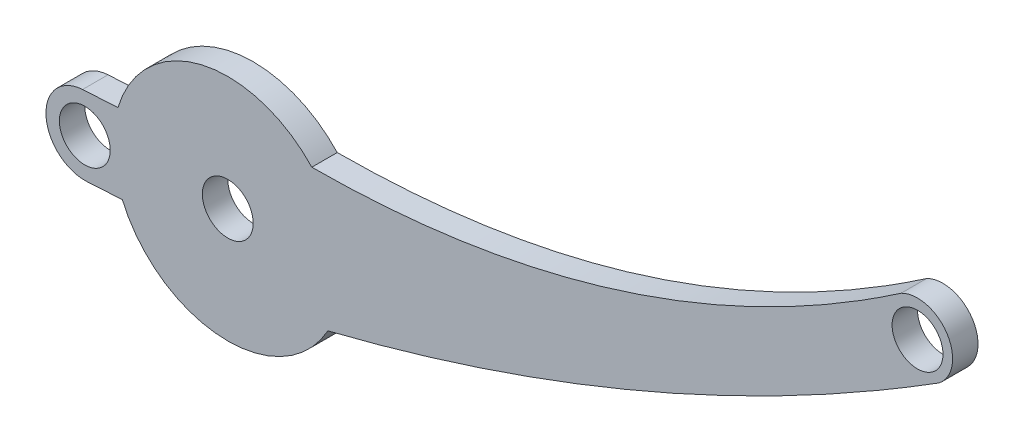
from build123d import *

# Parameters (mm, degrees)
SKETCH1_R           = 4
BOSS_EXTRUDE1_DEPTH = 2
SHELL1_START        = -2
SHELL1_OUTLINE_R    = 4.8
SHELL1_DEPTH        = 3.2


# Read off the part's stored shape, not the designer's step: Shell1
with BuildPart() as part:
    # Sketch1 → Boss-Extrude1 (new, symmetric)
    with BuildSketch(Plane.XY):
        with BuildLine():
            Line((-17.273333042, 5.134508518), (-22.834943086, 4.817083449))
            ThreePointArc((-22.834943086, 4.817083449), (-28.587261134, -1.63159827), (-22.138579415, -7.383916318))
            Line((-22.138579415, -7.383916318), (-16.576969371, -7.066491249))
            ThreePointArc((-16.576969371, -7.066491249), (-0.944763396, -17.995517059), (15.7458991, -8.7634396))
            add(Edge.make_bspline(
                [(15.7458991, -8.7634396), (67.083909385, 4.041585312), (111.853607553, 32.193205755)],
                knots=[0, 0, 0, 1, 1, 1], degree=2))
            ThreePointArc((111.853607553, 32.193205755), (113.10751986, 39.543134952), (105.896265572, 41.438277917))
            add(Edge.make_bspline(
                [(105.896265572, 41.438277917), (63.525953211, 12.424095607), (13.212454281, 12.254071322)],
                knots=[0.987896241, 0.987896241, 0.987896241, 1.987896241, 1.987896241, 1.987896241], degree=2))
            ThreePointArc((13.212454281, 12.254071322), (-4.098137102, 17.548119112), (-17.273333042, 5.134508518))
        make_face()
        with Locations((-22.486761251, -1.283416434)):
            Circle(SKETCH1_R, mode=Mode.SUBTRACT)
        Circle(SKETCH1_R, mode=Mode.SUBTRACT)
        with Locations((108.469927907, 36.408671583)):
            Circle(SKETCH1_R, mode=Mode.SUBTRACT)
    extrude(amount=BOSS_EXTRUDE1_DEPTH, both=True)

    # Shell1 outline → Shell1 (cut)
    with BuildSketch(Plane.XY.offset(SHELL1_START)):
        with BuildLine():
            ThreePointArc((-16.051816298, -6.235216567), (-1.010183418, -17.190644594), (15.211053739, -8.072334002))
            add(Edge.make_bspline(
                [(15.211053739, -8.072334002), (15.222385933, -8.06950746), (15.233718127, -8.066680918), (15.245050322, -8.063854377), (15.256382516, -8.061027835), (15.26771471, -8.058201293), (15.279046904, -8.055374751), (15.290379098, -8.05254821), (15.301711293, -8.049721668), (15.313043487, -8.046895126), (15.324375681, -8.044068584), (15.354121011, -8.036649331), (15.372534147, -8.03205662), (15.390947283, -8.027463909), (15.409360418, -8.022871197), (15.427773554, -8.018278486), (15.44618669, -8.013685775), (15.464599826, -8.009093063), (15.483012962, -8.004500352), (15.501426097, -7.999907641), (15.519839233, -7.995314929), (15.540554011, -7.990148129), (15.542858699, -7.989573289), (15.545136117, -7.989005183), (15.547530208, -7.988408212), (15.549617399, -7.987887312), (15.552237019, -7.987234194), (15.554249413, -7.98673216), (15.556693958, -7.986122386), (15.558944951, -7.985560901), (15.5612476, -7.984986493), (15.56583998, -7.983840868), (15.568136163, -7.983268038), (15.570432338, -7.982695192), (15.572728507, -7.982122328), (15.575024668, -7.981549448), (15.577320821, -7.980976551), (15.579616968, -7.980403637), (15.581913107, -7.979830706), (15.584209239, -7.979257758), (15.586505364, -7.978684793), (15.593393716, -7.976965848), (15.597985921, -7.975819817), (15.602578098, -7.974673718), (15.607170246, -7.973527552), (15.611762364, -7.972381317), (15.616354454, -7.971235016), (15.620946514, -7.970088646), (15.625538546, -7.968942209), (15.630130548, -7.967795704), (15.634722521, -7.966649131), (15.648498354, -7.96320921), (15.657682126, -7.960915659), (15.666865782, -7.958621837), (15.676049322, -7.956327744), (15.685232745, -7.954033381), (15.694416052, -7.951738746), (15.703599244, -7.949443841), (15.712782318, -7.947148666), (15.721965277, -7.944853219), (15.731148119, -7.942557502), (15.77706175, -7.931077562), (15.813790795, -7.921889279), (15.85051798, -7.912696664), (15.887243306, -7.903499717), (15.923966772, -7.894298439), (15.960688378, -7.885092829), (15.997408124, -7.875882887), (16.034126012, -7.866668613), (16.070842039, -7.857450008), (16.107556207, -7.848227071), (16.291117748, -7.802090727), (16.437937227, -7.765112345), (16.584726952, -7.728064656), (16.731486924, -7.690947659), (16.878217144, -7.653761355), (17.02491761, -7.616505744), (17.171588325, -7.579180826), (17.318229287, -7.5417866), (17.464840497, -7.504323068), (17.611421956, -7.466790228), (18.05107708, -7.353983788), (18.34406149, -7.278502266), (18.636926899, -7.202743515), (18.929673307, -7.126707537), (19.222300717, -7.050394331), (19.514809132, -6.973803896), (19.807198553, -6.896936234), (20.099468984, -6.819791344), (20.391620426, -6.742369227), (20.683652882, -6.664669882), (21.559393298, -6.430740165), (22.142744307, -6.273678112), (22.725619399, -6.11550715), (23.308018593, -5.956227279), (23.889941907, -5.795838499), (24.471389362, -5.63434081), (25.052360976, -5.471734213), (25.632856767, -5.308018707), (26.212876755, -5.143194292), (26.792420958, -4.977260969), (28.529626269, -4.476134272), (29.68586008, -4.137614183), (30.84019098, -3.794658457), (31.992619122, -3.447267078), (33.143144661, -3.095440033), (34.29176775, -2.739177308), (35.438488542, -2.378478888), (36.583307191, -2.01334476), (37.726223851, -1.64377491), (38.867238673, -1.269769323), (42.284578093, -0.134445311), (44.55519768, 0.640180196), (46.818211791, 1.432548876), (49.073621643, 2.242661072), (51.32142845, 3.070517125), (53.561633431, 3.916117378), (55.794237801, 4.779462172), (58.019242777, 5.660551849), (60.236649574, 6.559386751), (62.44645941, 7.47596722), (68.878655155, 10.20493448), (73.080612538, 12.065048094), (77.254554243, 13.99063813), (81.400488497, 15.981708647), (85.518423161, 18.038264067), (89.608365726, 20.16030918), (93.67032332, 22.347849143), (97.704302702, 24.600889477), (101.710310261, 26.919436071), (105.688352025, 29.30349518), (109.638433649, 31.753073424)],
                knots=[-0.003323428, -0.003323428, -0.003323428, -0.003323428, -0.003323428, -0.003323428, -0.003323428, -0.003323428, -0.003323428, -0.003323428, -0.003323428, -0.003323428, -0.002109375, -0.002109375, -0.002109375, -0.002109375, -0.002109375, -0.002109375, -0.002109375, -0.002109375, -0.002109375, -0.002109375, -0.000136719, -0.000136719, -0.000136719, -0.000136719, -0.000136719, -0.000136719, -0.000136719, -0.000136719, -0.000136719, -0.000136719, 0.000109863, 0.000109863, 0.000109863, 0.000109863, 0.000109863, 0.000109863, 0.000109863, 0.000109863, 0.000109863, 0.000109863, 0.000356445, 0.000356445, 0.000356445, 0.000356445, 0.000356445, 0.000356445, 0.000356445, 0.000356445, 0.000356445, 0.000356445, 0.000849609, 0.000849609, 0.000849609, 0.000849609, 0.000849609, 0.000849609, 0.000849609, 0.000849609, 0.000849609, 0.000849609, 0.001835937, 0.001835937, 0.001835937, 0.001835937, 0.001835937, 0.001835937, 0.001835937, 0.001835937, 0.001835937, 0.001835937, 0.00578125, 0.00578125, 0.00578125, 0.00578125, 0.00578125, 0.00578125, 0.00578125, 0.00578125, 0.00578125, 0.00578125, 0.0215625, 0.0215625, 0.0215625, 0.0215625, 0.0215625, 0.0215625, 0.0215625, 0.0215625, 0.0215625, 0.0215625, 0.053125, 0.053125, 0.053125, 0.053125, 0.053125, 0.053125, 0.053125, 0.053125, 0.053125, 0.053125, 0.11625, 0.11625, 0.11625, 0.11625, 0.11625, 0.11625, 0.11625, 0.11625, 0.11625, 0.11625, 0.2425, 0.2425, 0.2425, 0.2425, 0.2425, 0.2425, 0.2425, 0.2425, 0.2425, 0.2425, 0.495, 0.495, 0.495, 0.495, 0.495, 0.495, 0.495, 0.495, 0.495, 0.495, 0.979998426, 0.979998426, 0.979998426, 0.979998426, 0.979998426, 0.979998426, 0.979998426, 0.979998426, 0.979998426, 0.979998426, 0.979998426, 0.979998426], degree=11))
            ThreePointArc((109.638433649, 31.753073424), (103.967828672, 38.073334454), (112.386109536, 39.184193417))
            ThreePointArc((112.386109536, 39.184193417), (109.645338699, 41.123948782), (106.30837764, 40.75089845))
            add(Edge.make_bspline(
                [(12.859642213, 11.452874497), (12.875559482, 11.452928286), (12.89147675, 11.452982075), (12.907394019, 11.453035864), (12.923311287, 11.453089654), (12.939228556, 11.453143443), (12.955145825, 11.453197232), (12.971063093, 11.453251021), (12.986980362, 11.45330481), (13.024953461, 11.453433133), (13.047009292, 11.453507666), (13.069065122, 11.453582199), (13.091120953, 11.453656732), (13.113176784, 11.453731266), (13.135232614, 11.453805799), (13.157288445, 11.453880332), (13.179344276, 11.453954865), (13.202778596, 11.454034057), (13.204157085, 11.454038715), (13.205535575, 11.454043373), (13.206914064, 11.454048032), (13.208292554, 11.45405269), (13.209671043, 11.454057348), (13.211049532, 11.454062007), (13.212428022, 11.454066665), (13.215185001, 11.454075982), (13.216554492, 11.454080606), (13.217987164, 11.45408545), (13.219302057, 11.454089949), (13.220750975, 11.45409485), (13.222097481, 11.454099473), (13.223496126, 11.454104254), (13.224878499, 11.454109002), (13.229032762, 11.454123302), (13.231802257, 11.454132885), (13.234571739, 11.454142516), (13.237341208, 11.454152197), (13.240110663, 11.454161926), (13.242880105, 11.454171704), (13.245649534, 11.454181531), (13.248418949, 11.454191408), (13.256727156, 11.454221183), (13.262265907, 11.454241229), (13.267804605, 11.454261471), (13.273343249, 11.454281908), (13.278881841, 11.454302541), (13.284420379, 11.45432337), (13.289958865, 11.454344395), (13.295497296, 11.454365616), (13.312112433, 11.454429865), (13.323188978, 11.45447348), (13.33426531, 11.454517879), (13.345341429, 11.45456306), (13.356417336, 11.454609025), (13.36749303, 11.454655773), (13.378568511, 11.454703304), (13.389643779, 11.454751618), (13.445019058, 11.454997102), (13.489315877, 11.455206018), (13.533609292, 11.455427463), (13.577899303, 11.455661437), (13.62218591, 11.455907939), (13.666469113, 11.45616697), (13.710748913, 11.456438529), (13.755025308, 11.456722618), (13.976390262, 11.458205705), (14.153427758, 11.459592636), (14.330410785, 11.461180031), (14.50733934, 11.46296789), (14.684213418, 11.464956217), (14.861033018, 11.467145013), (15.037798135, 11.469534279), (15.214508768, 11.472124018), (15.7444772, 11.480494658), (16.097571535, 11.486876983), (16.450447892, 11.494061221), (16.803106245, 11.502047384), (17.155546567, 11.510835488), (17.507768833, 11.520425545), (17.859773016, 11.53081757), (18.211559091, 11.542011578), (19.266262913, 11.577999586), (19.968526266, 11.605199584), (20.669916866, 11.635607671), (21.370434487, 11.669223941), (22.070078905, 11.706048488), (22.768849895, 11.746081409), (23.466747231, 11.789322799), (24.163770688, 11.835772751), (26.252218749, 11.984748583), (27.641021145, 12.096900641), (29.026325206, 12.221887985), (30.408128907, 12.359711064), (31.786430221, 12.510370327), (33.161227125, 12.673866223), (34.532517592, 12.850199202), (35.900299598, 13.039369712), (39.993114157, 13.645395185), (42.707615071, 14.100763008), (45.408056156, 14.607483418), (48.094419774, 15.16555678), (50.76668835, 15.774982078), (53.424844378, 16.435756921), (56.068870417, 17.147877537), (58.698749092, 17.911338773), (66.541035798, 20.354212331), (71.711057703, 22.187245864), (76.824392267, 24.225184187), (81.880917363, 26.467954887), (86.880527203, 28.915468978), (91.823134257, 31.567626244), (96.708671175, 34.424320569), (101.53709271, 37.485445273), (106.30837764, 40.75089845)],
                knots=[-0.003533003, -0.003533003, -0.003533003, -0.003533003, -0.003533003, -0.003533003, -0.003533003, -0.003533003, -0.003533003, -0.003533003, -0.002109375, -0.002109375, -0.002109375, -0.002109375, -0.002109375, -0.002109375, -0.002109375, -0.002109375, -0.000136719, -0.000136719, -0.000136719, -0.000136719, -0.000136719, -0.000136719, -0.000136719, -0.000136719, -1.3428e-05, -1.3428e-05, -1.3428e-05, -1.3428e-05, -1.3428e-05, -1.3428e-05, -1.3428e-05, -1.3428e-05, 0.000109863, 0.000109863, 0.000109863, 0.000109863, 0.000109863, 0.000109863, 0.000109863, 0.000109863, 0.000356445, 0.000356445, 0.000356445, 0.000356445, 0.000356445, 0.000356445, 0.000356445, 0.000356445, 0.000849609, 0.000849609, 0.000849609, 0.000849609, 0.000849609, 0.000849609, 0.000849609, 0.000849609, 0.001835937, 0.001835937, 0.001835937, 0.001835937, 0.001835937, 0.001835937, 0.001835937, 0.001835937, 0.00578125, 0.00578125, 0.00578125, 0.00578125, 0.00578125, 0.00578125, 0.00578125, 0.00578125, 0.0215625, 0.0215625, 0.0215625, 0.0215625, 0.0215625, 0.0215625, 0.0215625, 0.0215625, 0.053125, 0.053125, 0.053125, 0.053125, 0.053125, 0.053125, 0.053125, 0.053125, 0.11625, 0.11625, 0.11625, 0.11625, 0.11625, 0.11625, 0.11625, 0.11625, 0.2425, 0.2425, 0.2425, 0.2425, 0.2425, 0.2425, 0.2425, 0.2425, 0.495, 0.495, 0.495, 0.495, 0.495, 0.495, 0.495, 0.495, 0.999531309, 0.999531309, 0.999531309, 0.999531309, 0.999531309, 0.999531309, 0.999531309, 0.999531309, 0.999531309, 0.999531309], degree=9))
            ThreePointArc((12.859642213, 11.452874497), (-4.019017915, 16.744737295), (-16.657009441, 4.368382832))
            Line((-16.657009441, 4.368382832), (-22.789357823, 4.018383265))
            ThreePointArc((-22.789357823, 4.018383265), (-27.78856095, -1.586013006), (-22.184164679, -6.585216134))
            Line((-22.184164679, -6.585216134), (-16.051816298, -6.235216567))
        make_face()
        with Locations((-22.486761251, -1.283416434)):
            Circle(SHELL1_OUTLINE_R, mode=Mode.SUBTRACT)
        Circle(SHELL1_OUTLINE_R, mode=Mode.SUBTRACT)
    extrude(amount=SHELL1_DEPTH, mode=Mode.SUBTRACT)


solid = part.part
